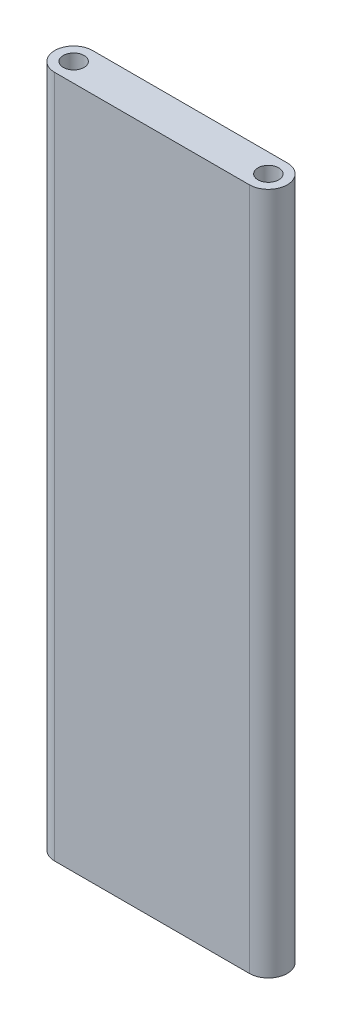
from build123d import *

# Parameters (mm, degrees)
SKETCH1_R           = 3.05
BOSS_EXTRUDE1_DEPTH = 100


with BuildPart() as part:
    # Sketch1 → Boss-Extrude1 (new, symmetric)
    with BuildSketch(Plane(origin=(0, 0, 0), x_dir=(1, 0, 0), z_dir=(0, 1, 0))):
        with BuildLine():
            Line((-28.5, 5.55), (28.5, 5.55))
            ThreePointArc((28.5, 5.55), (34.05, 0), (28.5, -5.55))
            Line((28.5, -5.55), (-28.5, -5.55))
            ThreePointArc((-28.5, -5.55), (-34.05, 0), (-28.5, 5.55))
        make_face()
        with Locations((-28.5, 0)):
            Circle(SKETCH1_R, mode=Mode.SUBTRACT)
        with Locations((28.5, 0)):
            Circle(SKETCH1_R, mode=Mode.SUBTRACT)
    extrude(amount=BOSS_EXTRUDE1_DEPTH, both=True)


solid = part.part
